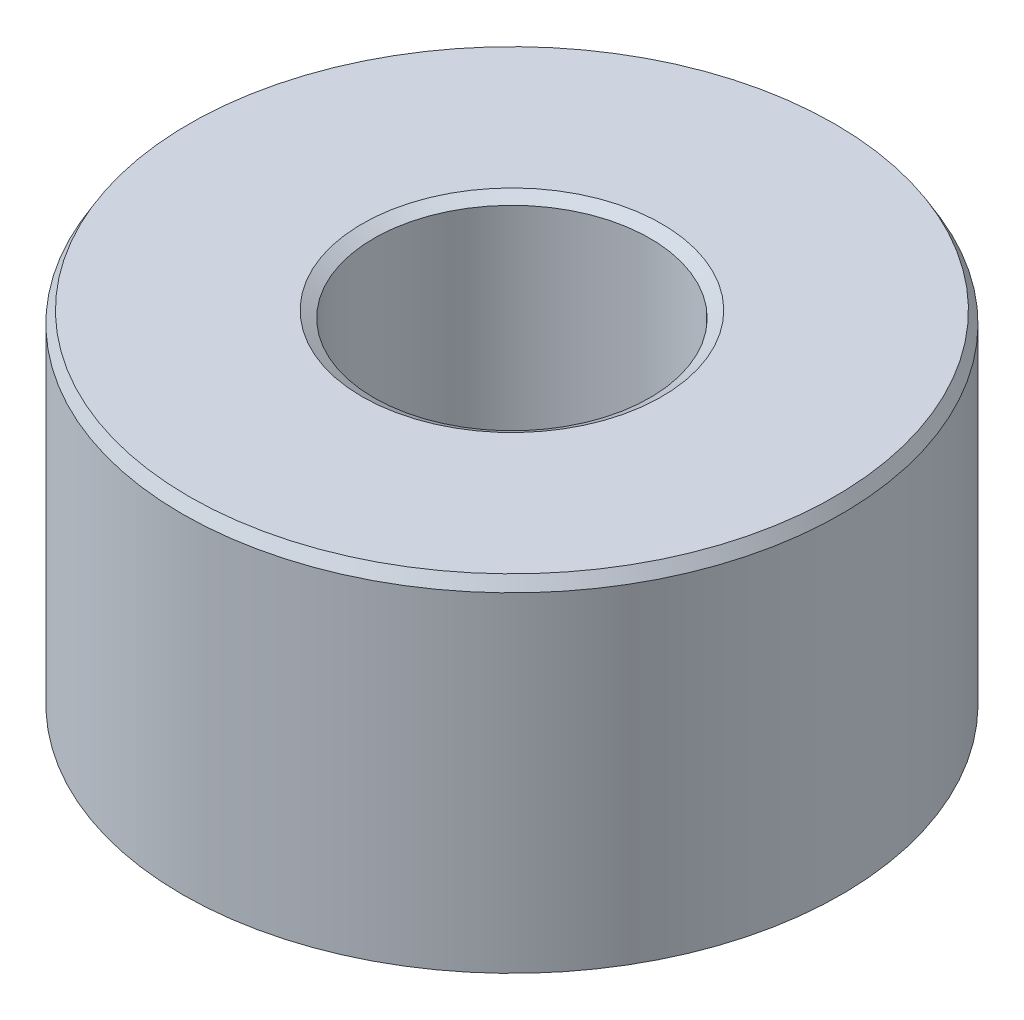
from build123d import *
from OCP.BRepFilletAPI import BRepFilletAPI_MakeChamfer

# Parameters (mm, degrees)
SKETCH1_R           = 60
BOSS_EXTRUDE1_DEPTH = 63.356935973
SKETCH2_R           = 25.139597862
CUT_EXTRUDE1_DEPTH  = 106.896654035
CHAMFER1_SIZE       = 2.131779688
CHAMFER1_SIZE2      = 1.230783577


with BuildPart() as part:
    # Sketch1 → Boss-Extrude1 (new body)
    with BuildSketch(Plane(origin=(0, 0, 0), x_dir=(1, 0, 0), z_dir=(0, 1, 0))):
        Circle(SKETCH1_R)
    extrude(amount=BOSS_EXTRUDE1_DEPTH)

    # Sketch2 → Cut-Extrude1 (cut, through all)
    with BuildSketch(Plane(origin=(0, 0, 0), x_dir=(1, 0, 0), z_dir=(0, 1, 0))):
        Circle(SKETCH2_R)
    extrude(amount=CUT_EXTRUDE1_DEPTH, mode=Mode.SUBTRACT)

    # Chamfer1: one chamfer whose edges measure the first distance from different faces: ONE call of the kernel's chamfer builder (chamfer() names one face for all edges)
    chamfer1_edges_1 = [part.edges().sort_by_distance(p)[0] for p in [
        (-25.139597862, 63.356935973, 0),
    ]]
    chamfer1_side_1 = [part.faces().sort_by_distance(p)[0] for p in [
        (-58.302943725, 63.356935973, 0),
    ]]
    chamfer1_edges_2 = [part.edges().sort_by_distance(p)[0] for p in [
        (-25.139597862, 0, 0),
    ]]
    chamfer1_side_2 = [part.faces().sort_by_distance(p)[0] for p in [
        (-25.139597862, 31.678467986, 0),
    ]]
    chamfer1_edges_3 = [part.edges().sort_by_distance(p)[0] for p in [
        (-60, 0, 0),
    ]]
    chamfer1_side_3 = [part.faces().sort_by_distance(p)[0] for p in [
        (-58.302943725, 0, 0),
    ]]
    chamfer1_edges_4 = [part.edges().sort_by_distance(p)[0] for p in [
        (-60, 63.356935973, 0),
    ]]
    chamfer1_side_4 = [part.faces().sort_by_distance(p)[0] for p in [
        (-60, 31.678467986, 0),
    ]]
    chamfer1 = BRepFilletAPI_MakeChamfer(part.part.solid().wrapped)
    for e in chamfer1_edges_1:
        chamfer1.Add(CHAMFER1_SIZE, CHAMFER1_SIZE2, e.wrapped, chamfer1_side_1[0].wrapped)  # the first distance lies on this face
    for e in chamfer1_edges_2:
        chamfer1.Add(CHAMFER1_SIZE, CHAMFER1_SIZE2, e.wrapped, chamfer1_side_2[0].wrapped)  # the first distance lies on this face
    for e in chamfer1_edges_3:
        chamfer1.Add(CHAMFER1_SIZE, CHAMFER1_SIZE2, e.wrapped, chamfer1_side_3[0].wrapped)  # the first distance lies on this face
    for e in chamfer1_edges_4:
        chamfer1.Add(CHAMFER1_SIZE, CHAMFER1_SIZE2, e.wrapped, chamfer1_side_4[0].wrapped)  # the first distance lies on this face
    add(Compound.cast(chamfer1.Shape()), mode=Mode.REPLACE)


solid = part.part
